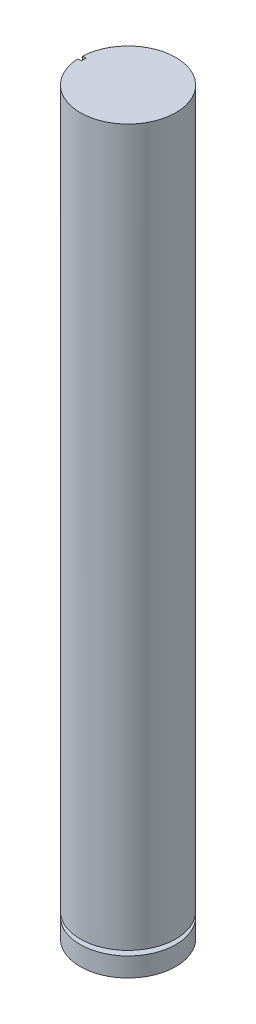
from build123d import *

# Parameters (mm, degrees)
SKETCH1_R           = 2
BOSS_EXTRUDE1_DEPTH = 30.929231204
SKETCH2_W           = 0.5
SKETCH2_H           = 0.2
SKETCH3_W           = 0.15
SKETCH3_H           = 0.2
CUT_EXTRUDE1_DEPTH  = 3


with BuildPart() as part:
    # Sketch1 → Boss-Extrude1 (new body)
    with BuildSketch(Plane(origin=(0, 0, 0), x_dir=(1, 0, 0), z_dir=(0, 1, 0))):
        Circle(SKETCH1_R)
    extrude(amount=BOSS_EXTRUDE1_DEPTH)

    # Sketch2 → Cut-Revolve1 (revolve, cut)
    with BuildSketch(Plane(origin=(0, 0, 0), x_dir=(0, 0, -1), z_dir=(1, 0, 0))):
        with Locations((1.75, 0.9)):
            Rectangle(SKETCH2_W, SKETCH2_H)
    revolve(axis=Axis((0, 0, 0), (0, 1, 0)), mode=Mode.SUBTRACT)

    # Sketch3 → Cut-Extrude1 (cut)
    with BuildSketch(Plane(origin=(0, 30.929231204, 0), x_dir=(1, 0, 0), z_dir=(0, 1, 0))):
        with Locations((-1.925, 0)):
            Rectangle(SKETCH3_W, SKETCH3_H)
    extrude(amount=-CUT_EXTRUDE1_DEPTH, mode=Mode.SUBTRACT)


solid = part.part
